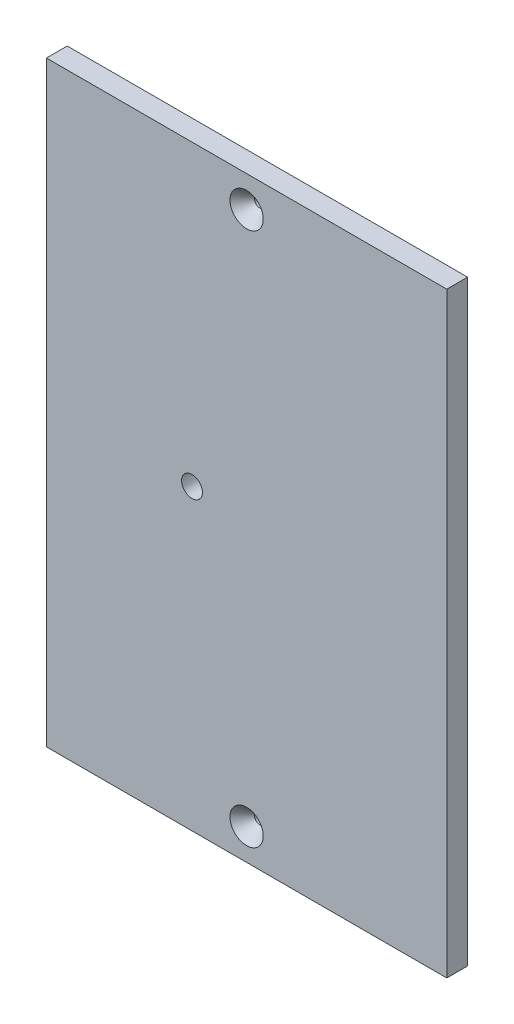
from build123d import *

# Parameters (mm, degrees)
SKETCH1_W                   = 122.237862113
SKETCH1_H                   = 182.149999994
BOSS_EXTRUDE1_DEPTH         = 6.35
F_1_4_0_25_DIAMETER_HOLE1_D = 6.35
HOLE1_D                     = 3.175
HOLE1_DEPTH                 = 31.75
HOLE1_CSINK_D               = 10.16
HOLE1_CSINK_ANGLE           = 82
HOLE1_TIP                   = 0.953866233


with BuildPart() as part:
    # Sketch1 → Boss-Extrude1 (new body)
    with BuildSketch(Plane.XY):
        with Locations((-295.871898238, -72.024999997)):
            Rectangle(SKETCH1_W, SKETCH1_H)
    extrude(amount=BOSS_EXTRUDE1_DEPTH)

    # 1/4 (0.25) Diameter Hole1 (through all)
    with Locations(Plane.XY.offset(6.35)):
        with Locations((-312.540829294, -72.024999997)):
            Hole(F_1_4_0_25_DIAMETER_HOLE1_D / 2)

    # Hole1
    with Locations(Plane(origin=(181.039434513, -72.024999997, 6.35), x_dir=(0, 1, 0), z_dir=(0, 0, 1))):
        with Locations((81.549999997, 476.911332751), (-81.549999997, 476.911332751)):
            CounterSinkHole(HOLE1_D / 2, HOLE1_CSINK_D / 2, depth=HOLE1_DEPTH, counter_sink_angle=HOLE1_CSINK_ANGLE)
            with Locations((0, 0, -(HOLE1_DEPTH + HOLE1_TIP / 2))):  # 118° drill point
                Cone(0, HOLE1_D / 2, HOLE1_TIP, mode=Mode.SUBTRACT)


solid = part.part
